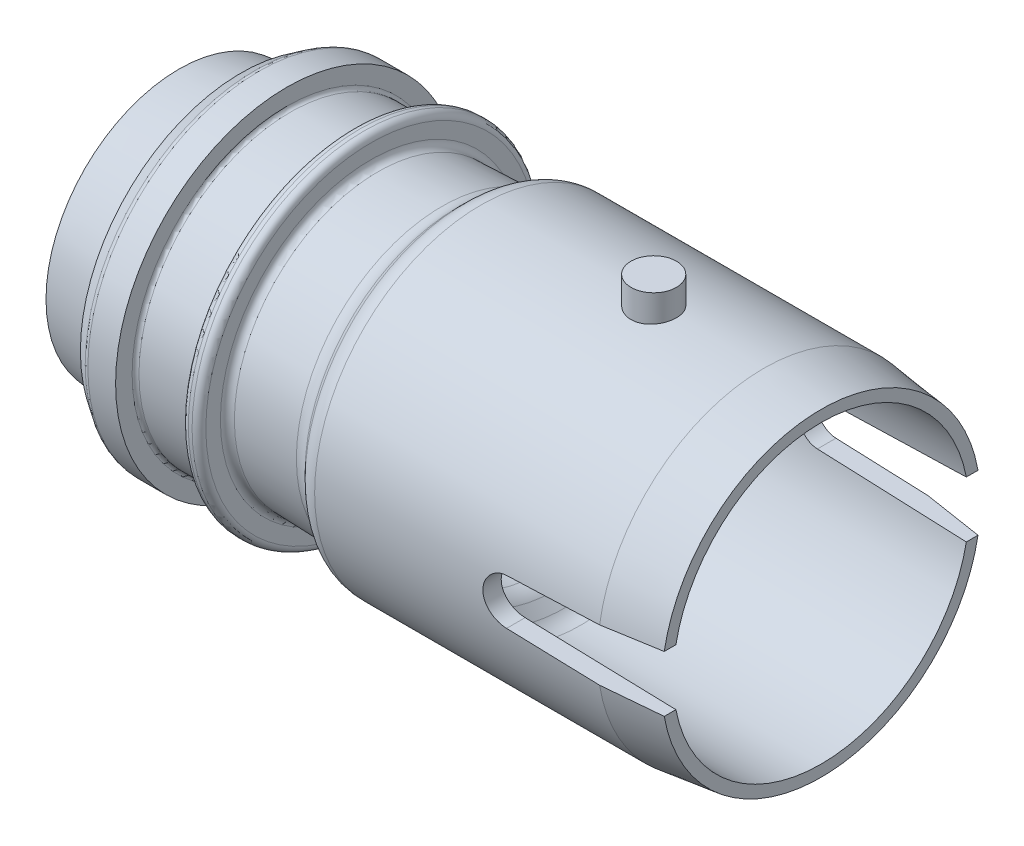
from build123d import *

# Parameters (mm, degrees)
CUT_EXTRUDE3_DEPTH       = 49.748817243
CUT_EXTRUDE3_DEPTH_BACK  = 49.748817243
BOSS_EXTRUDE1_REACH      = 62.366
BOSS_EXTRUDE1_END_RADIUS = 18.415
SKETCH3_R                = 2.5146
FILLET1_R                = 0.762
CHAMFER1_SIZE            = 2.794
CHAMFER1_SIZE_2          = 2.888956472
FILLET2_R                = 0.381
FILLET3_R                = 2.54


with BuildPart() as part:
    # Sketch1 → Revolve1 (revolve)
    with BuildSketch(Plane.XY, mode=Mode.PRIVATE) as revolve1_sk:
        Polygon((-40.64, 13.7795), (0, 13.7795), (0, 16.383), (30.48, 16.383), (30.48, 17.653), (24.13, 18.415), (-7.62, 18.415), (-7.62, 16.256), (-19.3929, 15.875), (-19.3929, 19.0373), (-21.336, 19.0373), (-21.336, 16.7513), (-28.702, 16.7513), (-28.702, 18.9611), (-32.004, 18.9611), (-33.782, 17.78), (-33.782, 15.621), (-40.64, 14.732), align=None)
    revolve(revolve1_sk.sketch.rotate(Axis((-11.776127049, 0, 0), (1, 0, 0)), 90), axis=Axis((-11.776127049, 0, 0), (1, 0, 0)))

    # Sketch2 → Cut-Extrude3 (cut, two sides: drawn at the far end of the back side and taken through both)
    with BuildSketch(Plane.XY.offset(-CUT_EXTRUDE3_DEPTH_BACK)):
        with BuildLine():
            Line((13.882361942, 2.538487654), (30.48, 3.1115))
            Line((30.48, 3.1115), (30.48, -3.1115))
            Line((30.48, -3.1115), (13.882361942, -2.538487654))
            ThreePointArc((13.882361942, -2.538487654), (11.43, 0), (13.882361942, 2.538487654))
        make_face()
    extrude(amount=CUT_EXTRUDE3_DEPTH + CUT_EXTRUDE3_DEPTH_BACK, mode=Mode.SUBTRACT)

    # Boss-Extrude1: up to this cylinder (the profile starts outside it)
    boss_extrude1_end = Plane(origin=(11.938, 0, 0), z_dir=(-1, 0, 0)) * Cylinder(BOSS_EXTRUDE1_END_RADIUS, 162.562, mode=Mode.PRIVATE)
    # Sketch3 → Boss-Extrude1 (add, up to the surface)
    with BuildSketch(Plane(origin=(0, 21.336, 0), x_dir=(1, 0, 0), z_dir=(0, 1, 0)), mode=Mode.PRIVATE) as boss_extrude1_sk1:
        with Locations(Location((11.938, 0, 0), (0, 0, 270))):
            Circle(SKETCH3_R)
    boss_extrude1_tool1 = extrude(boss_extrude1_sk1.sketch, amount=-BOSS_EXTRUDE1_REACH, mode=Mode.PRIVATE) - boss_extrude1_end
    boss_extrude1 = boss_extrude1_tool1.solids().sort_by_distance((11.938, 21.336, 0))[0]
    add(boss_extrude1)

    # Mirror1: Boss-Extrude1 across plane
    add(boss_extrude1.mirror(Plane.ZX))

    # Fillet1
    fillet1_edges = [part.edges().sort_by_distance(p)[0] for p in [
        (-32.004, 0, -18.9611),
        (-21.336, 0, -16.7513),
        (-21.336, 0, -19.0373),
        (-19.3929, 0, -19.0373),
        (-19.3929, 0, -15.875),
    ]]
    fillet(fillet1_edges, radius=FILLET1_R)

    # Chamfer1
    # the kernel refuses this chamfer: 2.888956472, 2.794 mm, written as the material it adds along each edge
    with BuildSketch(Plane(origin=(0, 0, 0), x_dir=(0, 0, 1), z_dir=(0, 1, 0))) as chamfer1_piece_1_section:
        Polygon((16.383 - CHAMFER1_SIZE, 0), (16.383, CHAMFER1_SIZE), (16.383, 0), align=None)
    chamfer1_piece_1 = revolve(axis=Axis((0, 0, 0), (1, 0, 0)), mode=Mode.PRIVATE)
    chamfer1_piece_1 = chamfer1_piece_1 - Plane(origin=(1.479100002, 0, 0), x_dir=(0, 0, 1), z_dir=(1, 0, 0)) * Cylinder(13.7795, 66, mode=Mode.PRIVATE)
    with BuildSketch(Plane(origin=(-7.62, 0, 0), x_dir=(0, 0, 1), z_dir=(0, 1, 0))) as chamfer1_piece_2_section:
        Polygon((16.256 + CHAMFER1_SIZE, 0), (16.256 - CHAMFER1_SIZE_2 * 0.0323455257839, -CHAMFER1_SIZE_2 * 0.999476746721), (16.256, 0), align=None)
    chamfer1_piece_2 = revolve(axis=Axis((-7.62, 0, 0), (1, 0, 0)), mode=Mode.PRIVATE)
    chamfer1_piece_2 = chamfer1_piece_2 & Plane(origin=(-9.368047324, 0, 0), x_dir=(0, 0, 1), z_dir=(-1, 0, 0)) * Cylinder(18.415, 77, mode=Mode.PRIVATE)
    add([chamfer1_piece_1, chamfer1_piece_2])

    # Fillet2
    fillet2_edges = [part.edges().sort_by_distance(p)[0] for p in [
        (-33.782, 0, -15.621),
        (-28.702, 0, -16.7513),
    ]]
    fillet(fillet2_edges, radius=FILLET2_R)

    # Fillet3
    fillet3_edges = [part.edges().sort_by_distance(p)[0] for p in [
        (-10.507444816, 0, -16.162555184),
        (2.794, 0, -16.383),
        (-8.255, 0, -18.415),
        (0.1905, 0, -13.7795),
    ]]
    fillet(fillet3_edges, radius=FILLET3_R)


solid = part.part
